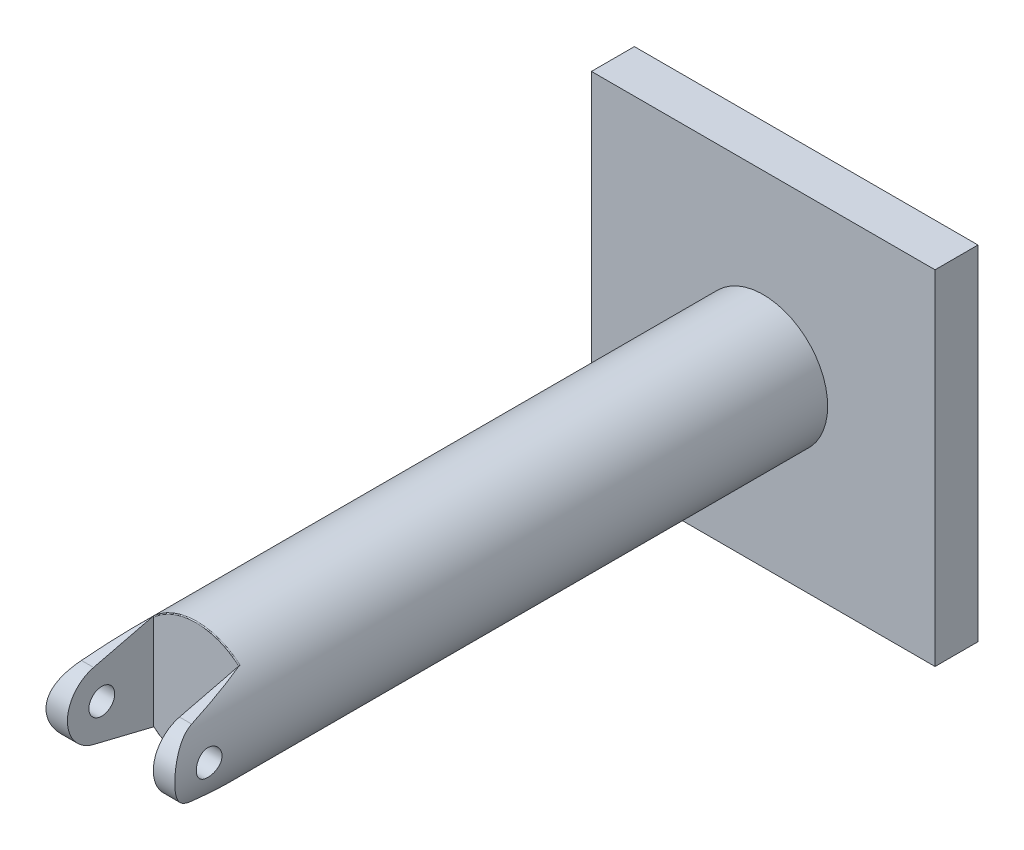
from build123d import *

# Parameters (mm, degrees)
SKETCH1_R               = 7.5
BOSS_EXTRUDE1_DEPTH     = 56
SKETCH2_W               = 10
SKETCH2_H               = 16
CUT_EXTRUDE1_DEPTH      = 10
CUT_EXTRUDE4_DEPTH      = 57.995613866
CUT_EXTRUDE4_DEPTH_BACK = 57.995613866
CUT_EXTRUDE5_DEPTH      = 57.995613991
CUT_EXTRUDE5_DEPTH_BACK = 57.995613991
SKETCH4_R               = 1.5
FILLET1_R               = 0.1
SKETCH5_W               = 7.5
SKETCH5_H               = 20
SKETCH6_W               = 40
SKETCH6_H               = 40
BOSS_EXTRUDE2_DEPTH     = 5


with BuildPart() as part:
    # Sketch1 → Boss-Extrude1 (new body)
    with BuildSketch(Plane.XY):
        Circle(SKETCH1_R)
    extrude(amount=BOSS_EXTRUDE1_DEPTH)

    # Sketch2 → Cut-Extrude1 (cut)
    with BuildSketch(Plane.XY.offset(56)):
        Rectangle(SKETCH2_W, SKETCH2_H)
    extrude(amount=-CUT_EXTRUDE1_DEPTH, mode=Mode.SUBTRACT)

    # Sketch3 → Cut-Extrude4 (cut, two sides: drawn at the far end of the back side and taken through both)
    with BuildSketch(Plane(origin=(0, 0, 0), x_dir=(0, 0, -1), z_dir=(1, 0, 0)).offset(-CUT_EXTRUDE4_DEPTH_BACK)):
        with BuildLine():
            Line((-46, -114.267763227), (-46, -7.5))
            Line((-46, -7.5), (-46, -5.590169944))
            Line((-46, -5.590169944), (-52.952744721, -3.885047998))
            ThreePointArc((-52.952744721, -3.885047998), (-55.999999999, -0.000262165), (-52.952923855, 3.884664175))
            Line((-52.952923855, 3.884664175), (-46, 5.590169944))
            Line((-46, 5.590169944), (-46, 7.5))
            Line((-46, 7.5), (-46, 114.267763227))
            Line((-46, 114.267763227), (-259.535526454, 114.267763227))
            Line((-259.535526454, 114.267763227), (-259.535526454, -114.267763227))
            Line((-259.535526454, -114.267763227), (-46, -114.267763227))
        make_face()
    extrude(amount=CUT_EXTRUDE4_DEPTH + CUT_EXTRUDE4_DEPTH_BACK, mode=Mode.SUBTRACT)

    # Sketch4 → Cut-Extrude5 (cut, two sides: drawn at the far end of the back side and taken through both)
    with BuildSketch(Plane(origin=(0, 0, 0), x_dir=(0, 0, -1), z_dir=(1, 0, 0)).offset(-CUT_EXTRUDE5_DEPTH_BACK)):
        with Locations(Location((-52, -0.000169944, 0), (0, 0, 0.006491373))):
            Circle(SKETCH4_R)
    extrude(amount=CUT_EXTRUDE5_DEPTH + CUT_EXTRUDE5_DEPTH_BACK, mode=Mode.SUBTRACT)

    # Fillet1
    # the kernel refuses this fillet: 0.1 mm, written as the material it takes off along each edge
    with BuildSketch(Plane(origin=(0, 0, 46), x_dir=(0.6911452834399255, -0.7227158481580054, 0), z_dir=(0.7227158481580054, 0.6911452834399255, 0))) as fillet1_piece_1_section:
        with BuildLine():
            CenterArc((7.5 - FILLET1_R, FILLET1_R), FILLET1_R, 270, 90)
            Line((7.5 - FILLET1_R, 0), (7.5, 0))
            Line((7.5, 0), (7.5, FILLET1_R))
        make_face()
    fillet1_piece_1 = revolve(axis=Axis((0, 0, 46), (0, 0, -1)), revolution_arc=87.441672972, mode=Mode.PRIVATE)
    fillet1_piece_1 = split(fillet1_piece_1, bisect_by=Plane(origin=(5, -5.569278278, 45.983069625), z_dir=(-1, 0, 0)), keep=Keep.TOP, mode=Mode.PRIVATE)
    fillet1_piece_1 = split(fillet1_piece_1, bisect_by=Plane(origin=(-5, -5.569278278, 45.983069625), z_dir=(1, 0, 0)), keep=Keep.TOP, mode=Mode.PRIVATE)
    add(fillet1_piece_1, mode=Mode.SUBTRACT)
    with BuildSketch(Plane(origin=(0, 0, 46), x_dir=(-0.6911452834399255, 0.7227158481580054, 0), z_dir=(-0.7227158481580054, -0.6911452834399255, 0))) as fillet1_piece_2_section:
        with BuildLine():
            CenterArc((7.5 - FILLET1_R, FILLET1_R), FILLET1_R, 270, 90)
            Line((7.5 - FILLET1_R, 0), (7.5, 0))
            Line((7.5, 0), (7.5, FILLET1_R))
        make_face()
    fillet1_piece_2 = revolve(axis=Axis((0, 0, 46), (0, 0, -1)), revolution_arc=87.441672972, mode=Mode.PRIVATE)
    fillet1_piece_2 = split(fillet1_piece_2, bisect_by=Plane(origin=(5, 5.569279246, 45.98306893), z_dir=(-1, 0, 0)), keep=Keep.TOP, mode=Mode.PRIVATE)
    fillet1_piece_2 = split(fillet1_piece_2, bisect_by=Plane(origin=(-5, 5.569279246, 45.98306893), z_dir=(1, 0, 0)), keep=Keep.TOP, mode=Mode.PRIVATE)
    add(fillet1_piece_2, mode=Mode.SUBTRACT)

    # Sketch5 → Revolve1 (revolve)
    with BuildSketch(Plane(origin=(0, 0, 0), x_dir=(1, 0, 0), z_dir=(0, 1, 0)), mode=Mode.PRIVATE) as revolve1_sk:
        with Locations((-3.75, 10)):
            Rectangle(SKETCH5_W, SKETCH5_H)
    revolve(revolve1_sk.sketch.rotate(Axis((0, 0, 0), (0, 0, -1)), 31.195191598), axis=Axis((0, 0, 0), (0, 0, -1)))

    # Sketch6 → Boss-Extrude2 (add)
    with BuildSketch(Plane(origin=(0, 0, -20), x_dir=(-1, 0, 0), z_dir=(0, 0, -1))):
        Rectangle(SKETCH6_W, SKETCH6_H)
    extrude(amount=BOSS_EXTRUDE2_DEPTH)


solid = part.part
